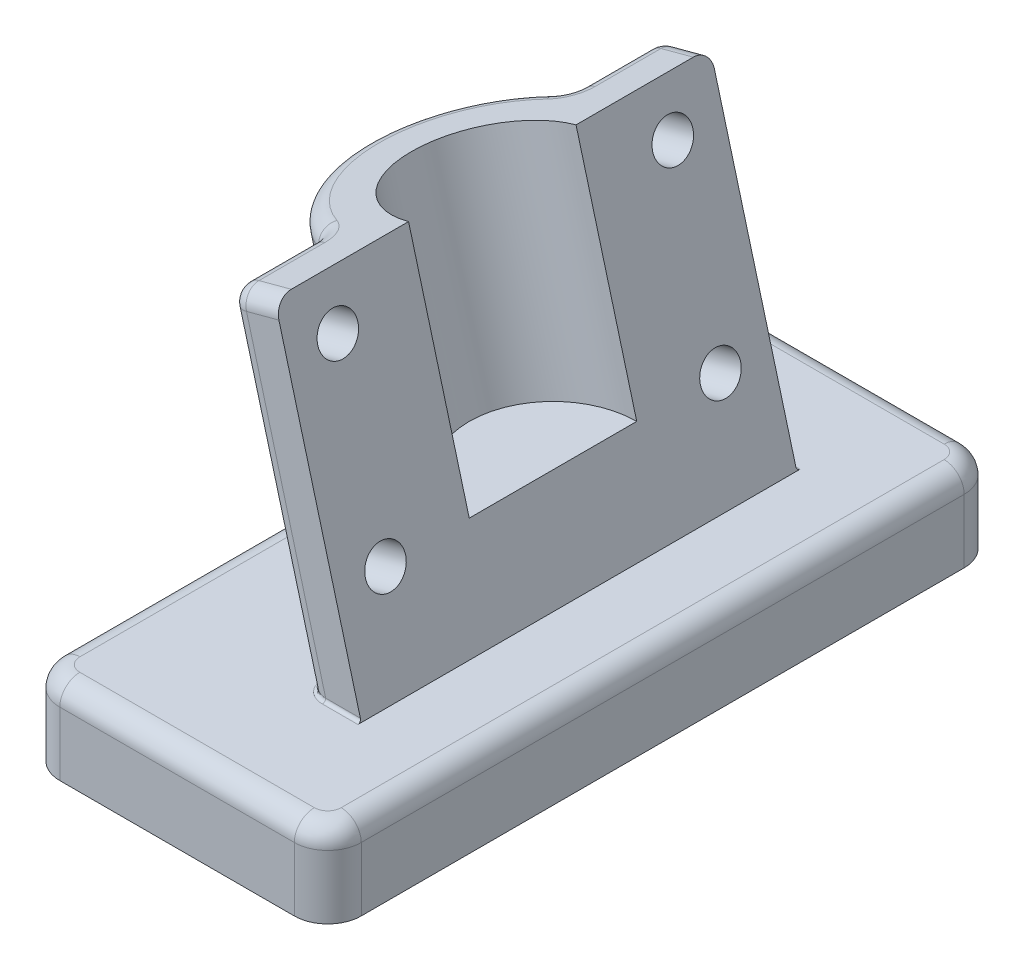
from build123d import *

# Parameters (mm, degrees)
SKETCH1_W           = 90
SKETCH1_H           = 200
BOSS_EXTRUDE1_DEPTH = 25
BOSS_EXTRUDE2_DEPTH = 65
CUT_EXTRUDE2_REACH  = 172.149
SKETCH9_R           = 6
CUT_EXTRUDE4_DEPTH  = 15
FILLET1_R           = 6
FILLET2_R           = 5
FILLET3_R           = 10
FILLET4_R           = 1


with BuildPart() as part:
    # Sketch1 → Boss-Extrude1 (new body)
    with BuildSketch(Plane(origin=(0, 0, 0), x_dir=(1, 0, 0), z_dir=(0, 1, 0))):
        Rectangle(SKETCH1_W, SKETCH1_H)
    extrude(amount=BOSS_EXTRUDE1_DEPTH)

    # Sketch3 → Boss-Extrude2 (add, symmetric)
    with BuildSketch(Plane.XY):
        Polygon((-21.411047216, 25), (-44.518937562, 111.239820825), (-5.88190451, 121.592582629), (20, 25), align=None)
    extrude(amount=BOSS_EXTRUDE2_DEPTH, both=True)

    # Cut-Extrude2: up to this plane
    cut_extrude2_end = Plane(origin=(0, 25, 0), z_dir=(0, -1, 0))
    # Sketch4 → Cut-Extrude2 (cut, up to the surface)
    with BuildSketch(Plane(origin=(-30.792158548, 114.917900176, 0), x_dir=(0.9659258262890673, 0.2588190451025248, 0), z_dir=(-0.2588190451025248, 0.9659258262890673, 0)), mode=Mode.PRIVATE) as cut_extrude2_sk1:
        with BuildLine():
            Line((10.788992653, 65), (10.788992653, 37.080992435))
            ThreePointArc((10.788992653, 37.080992435), (-7.37725525, 22.360679775), (-14.211007347, 0))
            Line((-14.211007347, 0), (-14.211007347, 65))
            Line((-14.211007347, 65), (10.788992653, 65))
        make_face()
    cut_extrude2_tool1 = split(extrude(cut_extrude2_sk1.sketch, amount=-CUT_EXTRUDE2_REACH, mode=Mode.PRIVATE), bisect_by=cut_extrude2_end, keep=Keep.BOTH, mode=Mode.PRIVATE)
    cut_extrude2 = cut_extrude2_tool1.solids().sort_by_distance((-33.920483, 114.079668, -44.986599))[0]
    add(cut_extrude2, mode=Mode.SUBTRACT)

    # Mirror1: Cut-Extrude2 across plane
    add(cut_extrude2.mirror(Plane.XY), mode=Mode.SUBTRACT)

    # Sketch6 → Cut-Loft1 section 0
    with BuildSketch(Plane(origin=(-30.792158548, 114.917900176, 0), x_dir=(0.9659258262890673, 0.2588190451025248, 0), z_dir=(-0.2588190451025248, 0.9659258262890673, 0))):
        with BuildLine():
            Line((25.788992653, 25), (25.788992653, -25))
            ThreePointArc((25.788992653, -25), (0.788992653, 0), (25.788992653, 25))
        make_face()
    # Sketch8 → Cut-Loft1 section 1
    with BuildSketch(Plane(origin=(0, 53.977774789, 0), x_dir=(1, 0, 0), z_dir=(0, 1, 0))):
        with BuildLine():
            Line((12.235428647, 25), (12.235428647, -25))
            ThreePointArc((12.235428647, -25), (-12.764571353, 0), (12.235428647, 25))
        make_face()
    loft(mode=Mode.SUBTRACT)

    # Sketch9 → Cut-Extrude4 (cut)
    with BuildSketch(Plane(origin=(24.910254038, 6.674682453, 0), x_dir=(0, 0, -1), z_dir=(0.9659258262890671, 0.25881904510252507, 0))):
        with Locations(Location((-50, 103.971764755, 0), (0, 0, 90))):
            Circle(SKETCH9_R)
        with Locations(Location((50, 103.971764755, 0), (0, 0, 90))):
            Circle(SKETCH9_R)
        with Locations(Location((50, 48.971764755, 0), (0, 0, 90))):
            Circle(SKETCH9_R)
        with Locations(Location((-50, 48.971764755, 0), (0, 0, 90))):
            Circle(SKETCH9_R)
    extrude(amount=-CUT_EXTRUDE4_DEPTH, mode=Mode.SUBTRACT)

    # Fillet1
    fillet1_edges = [part.edges().sort_by_distance(p)[0] for p in [
        (0, 25, 100),
        (-45, 25, 0),
        (0, 25, -100),
        (45, 25, 0),
    ]]
    fillet(fillet1_edges, radius=FILLET1_R)

    # Fillet2
    fillet2_edges = [part.edges().sort_by_distance(p)[0] for p in [
        (-7.949967305, 71.355148476, 65),
        (-7.949967305, 71.355148476, -65),
        (-7.949967305, 71.355148476, -37.080992435),
        (-7.949967305, 71.355148476, 37.080992435),
        (-13.126348207, 119.651439791, 65),
        (-13.126348207, 119.651439791, -65),
        (-20.370791905, 117.710296952, 51.040496218),
        (-20.370791905, 117.710296952, -51.040496218),
        (-44.518937562, 111.239820825, 0),
    ]]
    fillet(fillet2_edges, radius=FILLET2_R)

    # Fillet3
    # the kernel refuses this fillet: 10 mm, written as the material it takes off along each edge
    with BuildSketch(Plane(origin=(-35, 25, 90), x_dir=(-1, 0, 0), z_dir=(0, 0, -1))) as fillet3_piece_1:
        with BuildLine():
            CenterArc((4, -6), 6, 0, 90)
            Line((10, -6), (10, 0))
            Line((10, 0), (4, 0))
        make_face()
    revolve(axis=Axis((-35, 25, 90), (0, 1, 0)), revolution_arc=90, mode=Mode.SUBTRACT)
    with BuildSketch(Plane(origin=(35, 25, 90), x_dir=(0, 0, 1), z_dir=(-1, 0, 0))) as fillet3_piece_2:
        with BuildLine():
            CenterArc((4, -6), 6, 0, 90)
            Line((10, -6), (10, 0))
            Line((10, 0), (4, 0))
        make_face()
    revolve(axis=Axis((35, 25, 90), (0, 1, 0)), revolution_arc=90, mode=Mode.SUBTRACT)
    with BuildSketch(Plane(origin=(-35, 25, -90), x_dir=(0, 0, -1), z_dir=(1, 0, 0))) as fillet3_piece_3:
        with BuildLine():
            CenterArc((4, -6), 6, 0, 90)
            Line((10, -6), (10, 0))
            Line((10, 0), (4, 0))
        make_face()
    revolve(axis=Axis((-35, 25, -90), (0, 1, 0)), revolution_arc=90, mode=Mode.SUBTRACT)
    with BuildSketch(Plane(origin=(35, 25, -90), x_dir=(1, 0, 0), z_dir=(0, 0, 1))) as fillet3_piece_4:
        with BuildLine():
            CenterArc((4, -6), 6, 0, 90)
            Line((10, -6), (10, 0))
            Line((10, 0), (4, 0))
        make_face()
    revolve(axis=Axis((35, 25, -90), (0, 1, 0)), revolution_arc=90, mode=Mode.SUBTRACT)
    with BuildSketch(Plane(origin=(-45, -25, -100), x_dir=(0, 0, 1), z_dir=(0, 1, 0)), Plane(origin=(-45, -25, 100), x_dir=(1, 0, 0), z_dir=(0, 1, 0))) as fillet3_piece_5:
        with BuildLine():
            CenterArc((FILLET3_R, FILLET3_R), FILLET3_R, 180, 90)
            Line((0, FILLET3_R), (0, 0))
            Line((0, 0), (FILLET3_R, 0))
        make_face()
    extrude(amount=50, mode=Mode.SUBTRACT)
    with BuildSketch(Plane(origin=(45, -25, -100), x_dir=(0, 0, 1), z_dir=(0, 1, 0)), Plane(origin=(45, -25, 100), x_dir=(-1, 0, 0), z_dir=(0, 1, 0))) as fillet3_piece_6:
        with BuildLine():
            CenterArc((FILLET3_R, -FILLET3_R), FILLET3_R, 90, 90)
            Line((0, -FILLET3_R), (0, 0))
            Line((0, 0), (FILLET3_R, 0))
        make_face()
    extrude(amount=50, mode=Mode.SUBTRACT)

    # Fillet4
    fillet4_edges = [part.edges().sort_by_distance(p)[0] for p in [
        (4.470857294, 25, 50.155644371),
        (4.470857294, 25, -50.155644371),
        (-15.096920099, 25, 21.230184598),
        (14.823619098, 25, 65),
        (14.823619098, 25, -65),
        (3.681591404, 25, 37.657515667),
        (3.681591404, 25, -37.657515667),
        (6.018830459, 25, 63.566029729),
        (6.018830459, 25, -63.566029729),
    ]]
    fillet(fillet4_edges, radius=FILLET4_R)


solid = part.part
